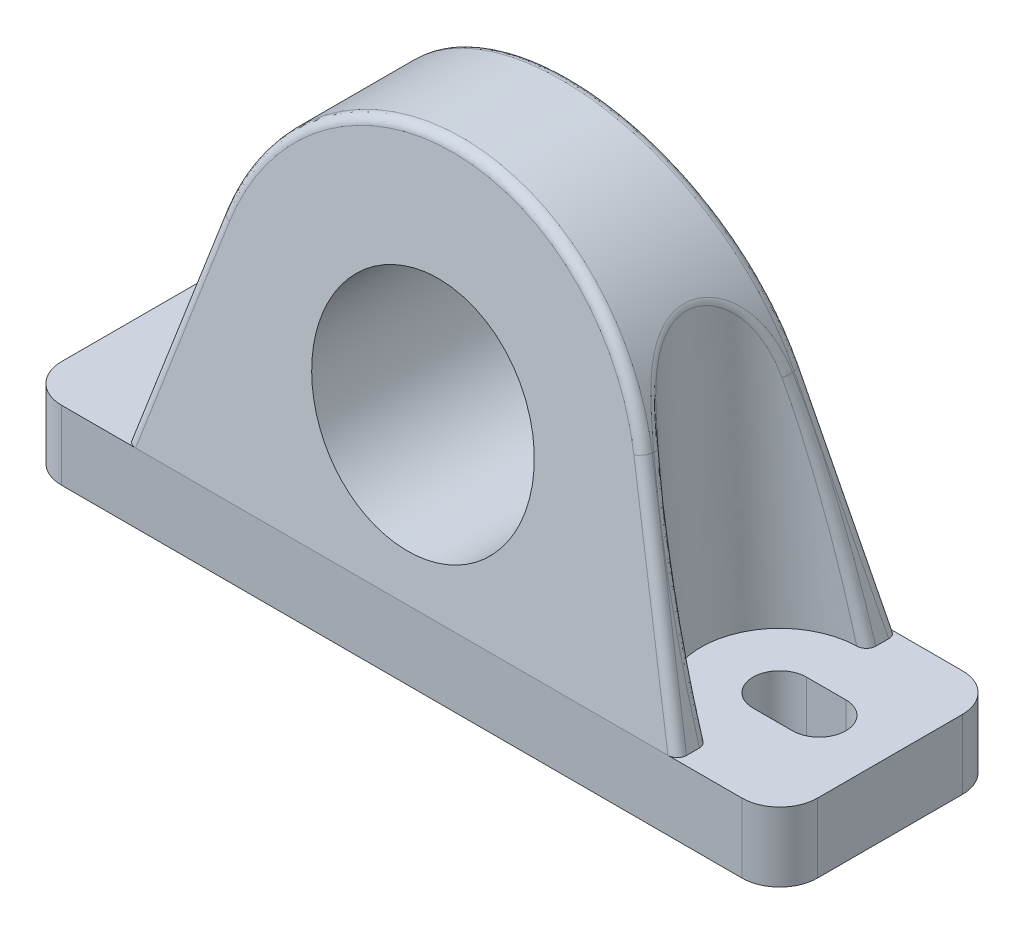
from build123d import *

# Parameters (mm, degrees)
SKETCH1_W               = 240
SKETCH1_H               = 70
BOSS_EXTRUDE1_DEPTH     = 22
SKETCH2_R               = 35
BOSS_EXTRUDE2_DEPTH     = 35
SKETCH3_R               = 25
CUT_EXTRUDE2_DEPTH      = 188.683243884
FILLET1_R               = 12
FILLET2_R               = 3
CUT_EXTRUDE3_DEPTH      = 172.898225862
CUT_EXTRUDE3_DEPTH_BACK = 172.898225862


with BuildPart() as part:
    # Sketch1 → Boss-Extrude1 (new body)
    with BuildSketch(Plane(origin=(0, 0, 0), x_dir=(1, 0, 0), z_dir=(0, 1, 0))):
        Rectangle(SKETCH1_W, SKETCH1_H)
    extrude(amount=BOSS_EXTRUDE1_DEPTH)

    # Sketch2 → Boss-Extrude2 (add, symmetric)
    with BuildSketch(Plane.XY):
        with BuildLine():
            Line((-67.043001826, 90.130472079), (-87.5, 22))
            Line((-87.5, 22), (87.5, 22))
            Line((87.5, 22), (67.043001826, 90.130472079))
            ThreePointArc((67.043001826, 90.130472079), (0, 140), (-67.043001826, 90.130472079))
        make_face()
        with Locations((0, 70)):
            Circle(SKETCH2_R, mode=Mode.SUBTRACT)
    extrude(amount=BOSS_EXTRUDE2_DEPTH, both=True)

    # Cut-Sweep1: sweep along a path in Sketch4
    with BuildLine(Plane.XY) as cut_sweep1_path:
        Line((-87.5, 22), (-80.777976476, 150.263849679))
    # Sketch3 → Cut-Sweep1 (sweep, cut)
    with BuildSketch(Plane(origin=(0, 22, 0), x_dir=(1, 0, 0), z_dir=(0, 1, 0))):
        with Locations((-85, 0)):
            Circle(SKETCH3_R)
    cut_sweep1 = sweep(path=cut_sweep1_path.line, mode=Mode.SUBTRACT)

    # Mirror1: Cut-Sweep1 across plane
    add(cut_sweep1.mirror(Plane(origin=(0, 0, 0), x_dir=(0, 0, 1), z_dir=(1, 0, 0))), mode=Mode.SUBTRACT)

    # Sketch5 → Cut-Extrude2 (cut, symmetric)
    with BuildSketch(Plane(origin=(0, 0, 0), x_dir=(0, 0, -1), z_dir=(1, 0, 0))):
        Polygon((-35, 22), (-18.416181505, 140), (-35, 140), align=None)
    cut_extrude2 = extrude(amount=CUT_EXTRUDE2_DEPTH, both=True, mode=Mode.SUBTRACT)

    # Mirror2: Cut-Extrude2 across plane
    add(cut_extrude2.mirror(Plane.XY), mode=Mode.SUBTRACT)

    # Fillet1
    fillet1_edges = [part.edges().sort_by_distance(p)[0] for p in [
        (-120, 11, -35),
        (-120, 11, 35),
        (120, 11, -35),
        (120, 11, 35),
    ]]
    fillet(fillet1_edges, radius=FILLET1_R)

    # Fillet2
    fillet2_edges = [part.edges().sort_by_distance(p)[0] for p in [
        (77.241568383, 56.164924049, 24.27722977),
        (77.241568383, 56.164924049, -24.27722977),
        (60.323169841, 105.512183541, -14.591238189),
        (77.271500913, 56.06523604, 30.212443293),
        (77.271500913, 56.06523604, -30.212443293),
        (-41.872237277, 126.095594706, 20.370318231),
        (-77.271500913, 56.06523604, 30.212443293),
        (-77.241568383, 56.164924049, 24.27722977),
        (-77.241568383, 56.164924049, -24.27722977),
        (-60.323169841, 105.512183541, 14.591238189),
        (-77.271500913, 56.06523604, -30.212443293),
        (-41.872237277, 126.095594706, -20.370318231),
    ]]
    fillet(fillet2_edges, radius=FILLET2_R)

    # Sketch6 → Cut-Extrude3 (cut, two sides: drawn at the far end of the back side and taken through both)
    with BuildSketch(Plane(origin=(0, 22, 0), x_dir=(1, 0, 0), z_dir=(0, 1, 0)).offset(-CUT_EXTRUDE3_DEPTH_BACK)):
        with BuildLine():
            Line((-85, -8.5), (-97.5, -8.5))
            ThreePointArc((-97.5, -8.5), (-106, 0), (-97.5, 8.5))
            Line((-97.5, 8.5), (-85, 8.5))
            ThreePointArc((-85, 8.5), (-76.5, 0), (-85, -8.5))
        make_face()
        with BuildLine():
            Line((85, -8.5), (97.5, -8.5))
            ThreePointArc((97.5, -8.5), (106, 0), (97.5, 8.5))
            Line((97.5, 8.5), (85, 8.5))
            ThreePointArc((85, 8.5), (76.5, 0), (85, -8.5))
        make_face()
    extrude(amount=CUT_EXTRUDE3_DEPTH + CUT_EXTRUDE3_DEPTH_BACK, mode=Mode.SUBTRACT)


solid = part.part
